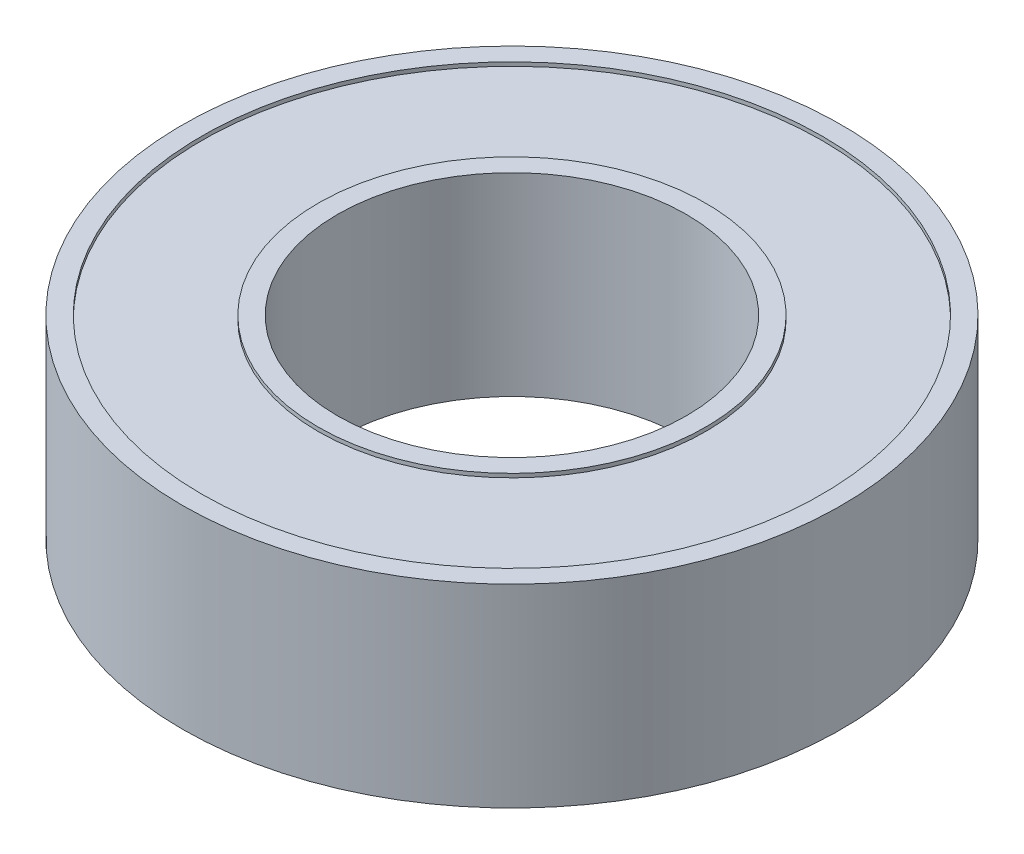
from build123d import *

# Parameters (mm, degrees)
SKETCH1_R           = 8.5
SKETCH1_R_2         = 4.5
BOSS_EXTRUDE1_DEPTH = 2.5
SKETCH2_R           = 8
SKETCH2_R_2         = 5
CUT_EXTRUDE1_DEPTH  = 0.1


with BuildPart() as part:
    # Sketch1 → Boss-Extrude1 (new, symmetric)
    with BuildSketch(Plane(origin=(0, 0, 0), x_dir=(1, 0, 0), z_dir=(0, 1, 0))):
        Circle(SKETCH1_R)
        Circle(SKETCH1_R_2, mode=Mode.SUBTRACT)
    extrude(amount=BOSS_EXTRUDE1_DEPTH, both=True)

    # Sketch2 → Cut-Extrude1 (cut)
    with BuildSketch(Plane(origin=(0, 2.5, 0), x_dir=(1, 0, 0), z_dir=(0, 1, 0))):
        Circle(SKETCH2_R)
        Circle(SKETCH2_R_2, mode=Mode.SUBTRACT)
    cut_extrude1 = extrude(amount=-CUT_EXTRUDE1_DEPTH, mode=Mode.SUBTRACT)

    # Mirror1: Cut-Extrude1 across plane
    add(cut_extrude1.mirror(Plane.ZX), mode=Mode.SUBTRACT)


solid = part.part
